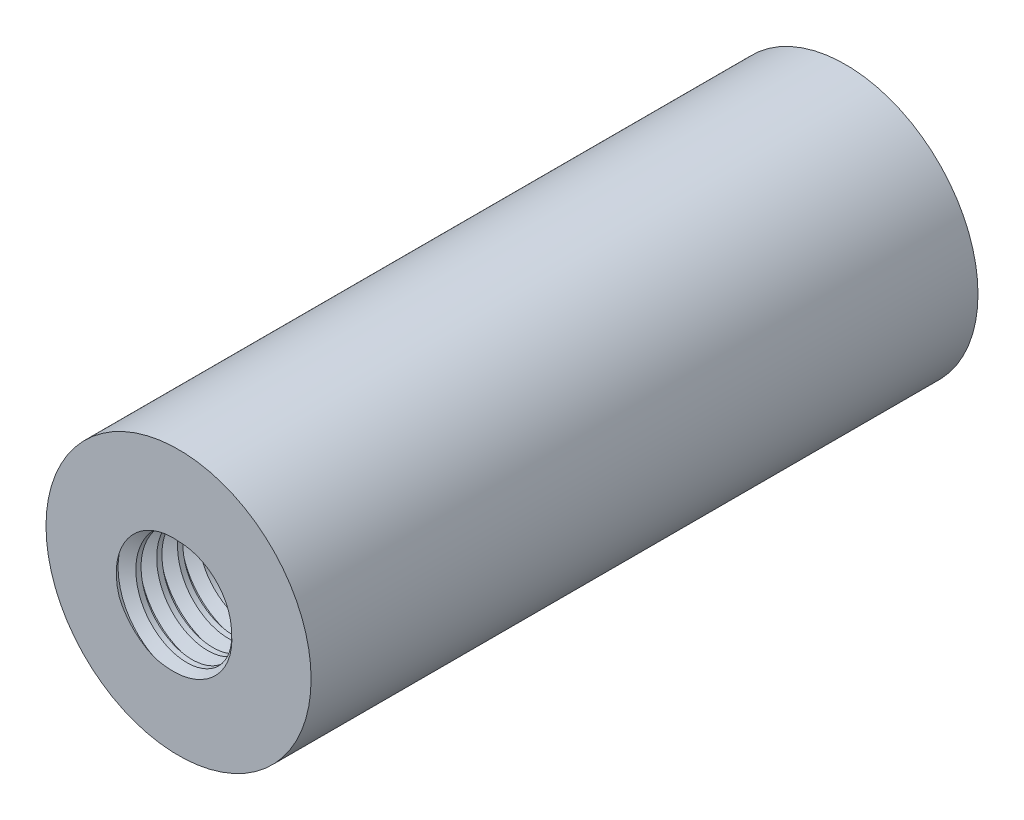
from build123d import *
from build123d.topology import SkipClean

# Parameters (mm, degrees)
SKETCH1_R           = 5.04825
BOSS_EXTRUDE1_DEPTH = 25.4
SKETCH3_R           = 2.0193
CUT_EXTRUDE1_DEPTH  = 27.384269103
THREAD1_PITCH       = 0.79375


with BuildPart() as part:
    # Sketch1 → Boss-Extrude1 (new body)
    with BuildSketch(Plane.XY):
        Circle(SKETCH1_R)
    extrude(amount=BOSS_EXTRUDE1_DEPTH)

    # Sketch3 → Cut-Extrude1 (cut, through all)
    with BuildSketch(Plane(origin=(0, 0, 0), x_dir=(-1, 0, 0), z_dir=(0, 0, -1))):
        Circle(SKETCH3_R)
    extrude(amount=-CUT_EXTRUDE1_DEPTH, mode=Mode.SUBTRACT)

    # Thread1: the profile of Thread Profile1 profile screwed along a right-hand helix of 32 turns, 8 arcs to a turn; built about Z, then put on its axis
    with SkipClean():  # the faces are left unmerged after this step: merging them gives an invalid solid
        thread1_z = Axis((0, 0, 0), (0, 0, 1))
        thread1_corners = [(2.019, 0, -0.000173205), (2.448929788, 0, 0.248046874), (2.448929788, 0, 0.347265624), (2.019, 0, 0.595485703)]
        with BuildLine(mode=Mode.PRIVATE) as thread1_profile:
            Line(thread1_corners[0], thread1_corners[1])
            Line(thread1_corners[1], thread1_corners[2])
            Line(thread1_corners[2], thread1_corners[3])
            Line(thread1_corners[3], thread1_corners[0])
        thread1_cap = Face(thread1_profile.wire())
        thread1_turn_angles = [0, 22.5, 45, 67.5, 90, 112.5, 135, 157.5, 180, 202.5, 225, 247.5, 270, 292.5, 315, 337.5, 360]
        thread1_turn_weights = [1, 0.9238795325112867, 1, 0.9238795325112867, 1, 0.9238795325112867, 1, 0.9238795325112867, 1, 0.9238795325112867, 1, 0.9238795325112867, 1, 0.9238795325112867, 1, 0.9238795325112867, 1]
        thread1_turn_rails = [Edge.make_bspline([Vector(p[0], p[1], 0).rotate(thread1_z, thread1_turn_angles[k]) / thread1_turn_weights[k] + Vector(0, 0, p[2] + THREAD1_PITCH * thread1_turn_angles[k] / 360) for k in range(17)], [0, 0, 0, 1, 1, 2, 2, 3, 3, 4, 4, 5, 5, 6, 6, 7, 7, 8, 8, 8], 2, thread1_turn_weights) for p in thread1_corners]
        thread1_turn_sides = [Face.make_surface_from_curves(thread1_turn_rails[p[0]], thread1_turn_rails[p[1]]) for p in [(0, 1), (1, 2), (2, 3), (3, 0)]]
        thread1 = Plane(origin=(0, 0, 0), x_dir=(1, 0, 0), z_dir=(0, 0, 1)) * Solid(Shell([*[p.moved(Location((0, 0, THREAD1_PITCH * i))) for i in range(32) for p in thread1_turn_sides], thread1_cap, thread1_cap.rotate(thread1_z, 11520).moved(Location((0, 0, THREAD1_PITCH * 11520 / 360)))]))
        add(thread1, mode=Mode.SUBTRACT)


solid = part.part
